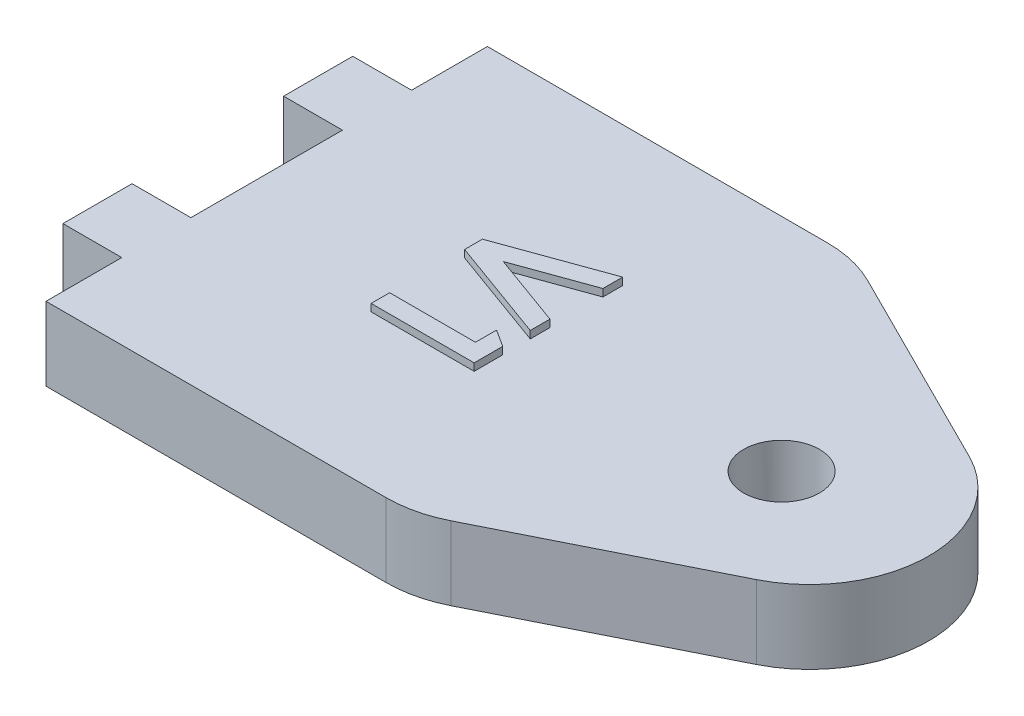
from build123d import *

# Parameters (mm, degrees)
BOSS_EXTRUDE2_DEPTH     = 10
CUT_EXTRUDE2_DEPTH      = 10
FILLET3_R               = 16
SKETCH8_W               = 8
SKETCH8_H               = 0.3
CUT_EXTRUDE5_DEPTH      = 10
SKETCH6_R               = 5.15
BOSS_EXTRUDE3_DEPTH     = 1
CUT_EXTRUDE7_DEPTH      = 109.724422279
CUT_EXTRUDE7_DEPTH_BACK = 109.724422279
SKETCH9_R               = 5.15


with BuildPart() as part:
    # Sketch1 → Boss-Extrude2 (new body)
    with BuildSketch(Plane(origin=(0, 0, 0), x_dir=(1, 0, 0), z_dir=(0, 1, 0))):
        Polygon((0, 0), (0, 10), (-8, 10), (-8, 20), (0, 20), (0, 40), (-8, 40), (-8, 50), (0, 50), (0, 60), (50, 60), (90, 40), (90, 20), (50, 0), align=None)
    extrude(amount=BOSS_EXTRUDE2_DEPTH)

    # Sketch5 → Cut-Extrude2 (cut)
    with BuildSketch(Plane(origin=(0, 10, 0), x_dir=(1, 0, 0), z_dir=(0, 1, 0))):
        with BuildLine():
            Line((90, 20), (90, 30))
            ThreePointArc((90, 30), (87.583479317, 21.493491916), (81.05572809, 15.527864045))
            Line((81.05572809, 15.527864045), (90, 20))
        make_face()
        with BuildLine():
            Line((90, 40), (81.05572809, 44.472135955))
            ThreePointArc((81.05572809, 44.472135955), (87.583479317, 38.506508084), (90, 30))
            Line((90, 30), (90, 40))
        make_face()
    extrude(amount=-CUT_EXTRUDE2_DEPTH, mode=Mode.SUBTRACT)

    # Fillet3
    fillet3_edges = [part.edges().sort_by_distance(p)[0] for p in [
        (50, 5, -60),
        (50, 5, 0),
    ]]
    fillet(fillet3_edges, radius=FILLET3_R)

    # Sketch8 → Cut-Extrude5 (cut)
    with BuildSketch(Plane(origin=(0, 10, 0), x_dir=(1, 0, 0), z_dir=(0, 1, 0))):
        with Locations((-4, 49.85)):
            Rectangle(SKETCH8_W, SKETCH8_H)
        with Locations((-4, 40.15)):
            Rectangle(SKETCH8_W, SKETCH8_H)
        with Locations((-4, 19.85)):
            Rectangle(SKETCH8_W, SKETCH8_H)
        with Locations((-4, 10.15)):
            Rectangle(SKETCH8_W, SKETCH8_H)
    extrude(amount=-CUT_EXTRUDE5_DEPTH, mode=Mode.SUBTRACT)

    # Sketch6 → Boss-Extrude3 (add)
    with BuildSketch(Plane(origin=(0, 10, 0), x_dir=(1, 0, 0), z_dir=(0, 1, 0))):
        with Locations((70, 30)):
            Circle(SKETCH6_R)
        Polygon((37.347743268, 41.048213922), (37.347743268, 38.364319691), (27.40303173, 34.76616264), (37.347743268, 31.159592127), (37.347743268, 28.484111358), (23.347743268, 33.560233153), (23.347743268, 35.980505589), align=None)
        Polygon((37.347743268, 24.740120973), (37.347743268, 20.85590623), (23.347743268, 20.85590623), (23.347743268, 23.368726743), (35.014409935, 23.368726743), (35.014409935, 26.240521614), align=None)
    extrude(amount=BOSS_EXTRUDE3_DEPTH)

    # Sketch9 → Cut-Extrude7 (cut, two sides: drawn at the far end of the back side and taken through both)
    with BuildSketch(Plane(origin=(0, 11, 0), x_dir=(1, 0, 0), z_dir=(0, 1, 0)).offset(-CUT_EXTRUDE7_DEPTH_BACK)):
        with Locations((70, 30)):
            Circle(SKETCH9_R)
    extrude(amount=CUT_EXTRUDE7_DEPTH + CUT_EXTRUDE7_DEPTH_BACK, mode=Mode.SUBTRACT)


solid = part.part
